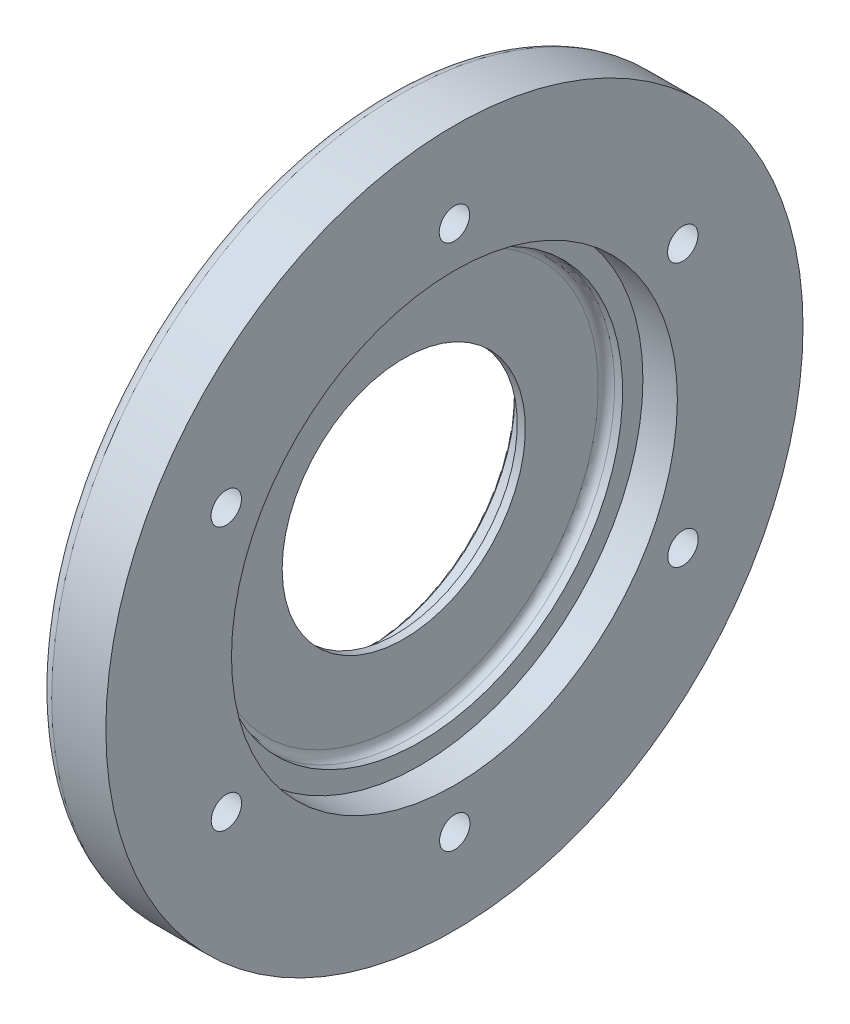
from build123d import *

# Parameters (mm, degrees)
FILLET1_R                  = 0.5
FILLET5_R                  = 5
SKETCH12_R                 = 86
SKETCH12_R_2               = 55
BOSS_EXTRUDE1_DEPTH        = 13.35
M14X2_0_TAPPED_HOLE2_D     = 12
M14X2_0_TAPPED_HOLE2_DEPTH = 16
M14X2_0_TAPPED_HOLE2_TIP   = 3.605163714


with BuildPart() as part:
    # Sketch1 → Revolve1 (revolve)
    with BuildSketch(Plane(origin=(0, 0, 0), x_dir=(1, 0, 0), z_dir=(0, 1, 0)), mode=Mode.PRIVATE) as revolve1_sk:
        with BuildLine():
            Line((0.595225647, 30), (2.595225647, 30))
            Line((2.595225647, 30), (2.595225647, 48))
            ThreePointArc((2.595225647, 48), (3.181012085, 49.414213562), (4.595225647, 50))
            Line((4.595225647, 50), (6.595225647, 50))
            Line((6.595225647, 50), (6.595225647, 55))
            Line((6.595225647, 55), (1.744360585, 55))
            Line((1.744360585, 55), (1.744360585, 86))
            Line((1.744360585, 86), (-2.255639415, 86))
            Line((-2.255639415, 86), (-2.255639415, 49))
            ThreePointArc((-2.255639415, 49), (-3.134319072, 46.878679656), (-5.255639415, 46))
            Line((-5.255639415, 46), (-6.404774353, 46))
            Line((-6.404774353, 46), (-6.404774353, 36))
            Line((-6.404774353, 36), (0.595225647, 36))
            Line((0.595225647, 36), (0.595225647, 30))
        make_face()
    revolve(revolve1_sk.sketch.rotate(Axis((0, 0, 0), (1, 0, 0)), 180), axis=Axis((0, 0, 0), (1, 0, 0)))

    # Fillet1
    fillet1_edges = [part.edges().sort_by_distance(p)[0] for p in [
        (-6.404774353, 0, -36),
    ]]
    fillet(fillet1_edges, radius=FILLET1_R)

    # Fillet5
    # the kernel refuses this fillet: 5 mm, written as the material it takes off along each edge
    with BuildSketch(Plane(origin=(-2.255639415, 0, 0), x_dir=(0, 0, 1), z_dir=(0, 1, 0))) as fillet5_piece_1:
        with BuildLine():
            CenterArc((81.101020514, 5), FILLET5_R, 270, 78.463040967)
            Line((86, 4), (86.09797959, 3.98))
            ThreePointArc((86.09797959, 3.98), (86.1, 2), (86.1, 0))
            Line((86.1, 0), (86, -0.1))
            Line((86, -0.1), (81.101020514, -0.1))
            Line((81.101020514, -0.1), (81.101020514, 0))
        make_face()
    revolve(axis=Axis((-2.255639415, 0, 0), (1, 0, 0)), mode=Mode.SUBTRACT)

    # Sketch12 → Boss-Extrude1 (add)
    with BuildSketch(Plane(origin=(1.744360585, 0, 0), x_dir=(0, 0, -1), z_dir=(1, 0, 0))):
        Circle(SKETCH12_R)
        with Locations(Location((0, 0, 0), (0, 0, 180))):
            Circle(SKETCH12_R_2, mode=Mode.SUBTRACT)
    extrude(amount=BOSS_EXTRUDE1_DEPTH)

    # M14x2.0 Tapped Hole2
    with Locations(Plane.ZY.offset(2.255639415)):
        with Locations((-56.335394412, 32.575765386), (0, 65.050510257), (56.291651246, 32.5), (56.24790808, -32.525255129), (-0.087486332, -65), (-56.379137578, -32.449489743)):
            Hole(M14X2_0_TAPPED_HOLE2_D / 2, depth=M14X2_0_TAPPED_HOLE2_DEPTH)
            with Locations((0, 0, -(M14X2_0_TAPPED_HOLE2_DEPTH + M14X2_0_TAPPED_HOLE2_TIP / 2))):  # 118° drill point
                Cone(0, M14X2_0_TAPPED_HOLE2_D / 2, M14X2_0_TAPPED_HOLE2_TIP, mode=Mode.SUBTRACT)


solid = part.part
